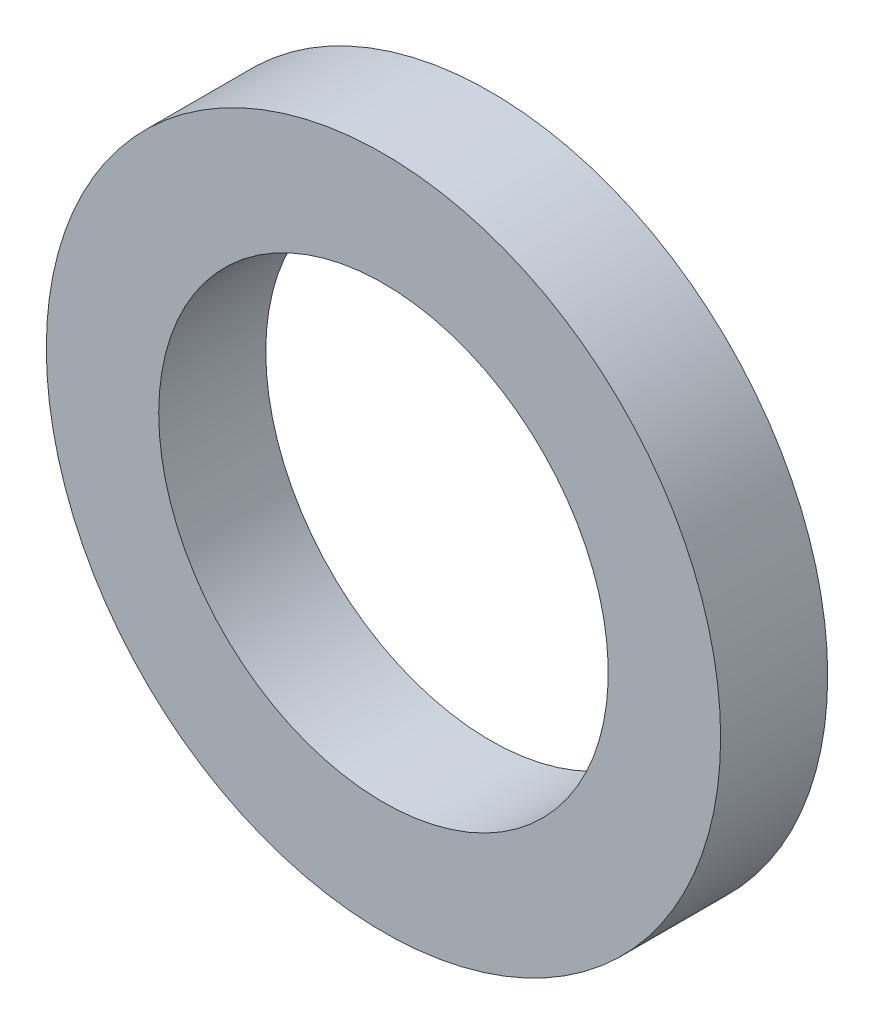
from build123d import *

# Parameters (mm, degrees)
SKETCH1_R           = 15
SKETCH1_R_2         = 10
BOSS_EXTRUDE1_DEPTH = 2.38125


with BuildPart() as part:
    # Sketch1 → Boss-Extrude1 (new, symmetric)
    with BuildSketch(Plane.XY):
        Circle(SKETCH1_R)
        Circle(SKETCH1_R_2, mode=Mode.SUBTRACT)
    extrude(amount=BOSS_EXTRUDE1_DEPTH, both=True)


solid = part.part
